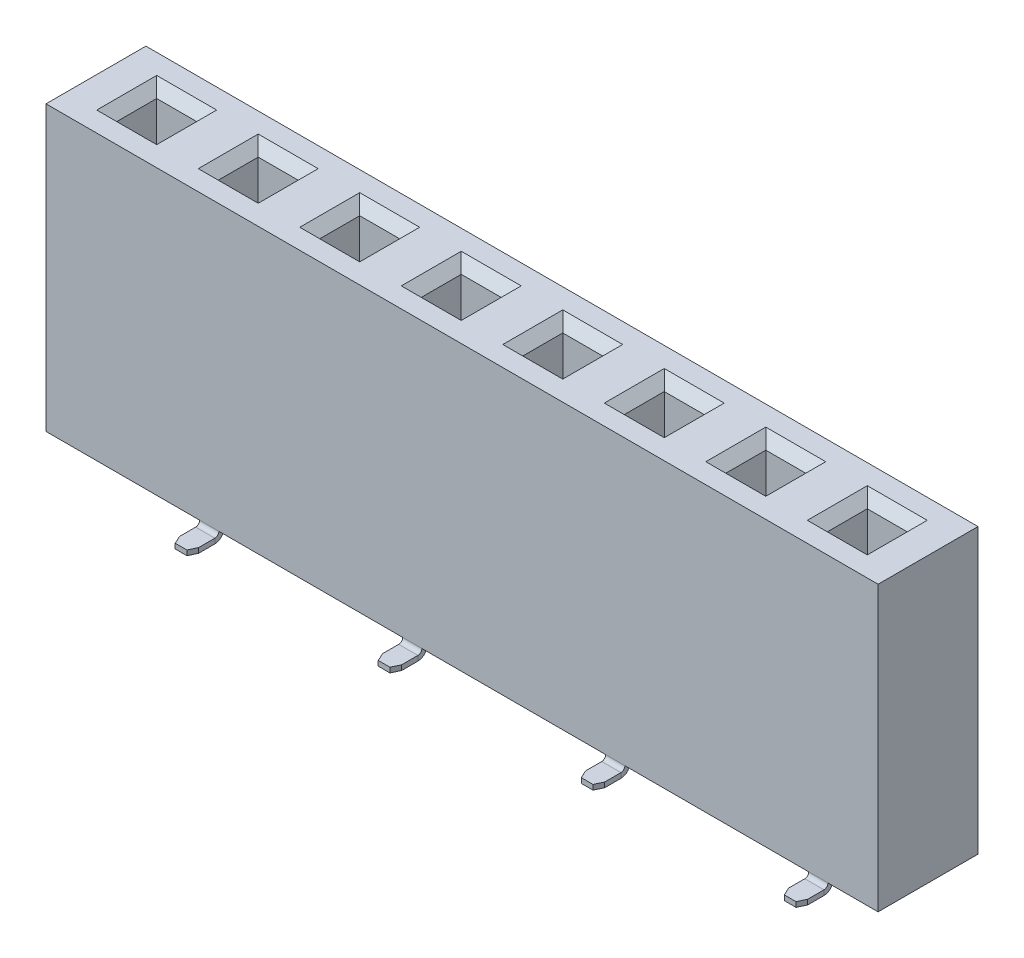
from build123d import *
from OCP.BRepFilletAPI import BRepFilletAPI_MakeChamfer

# Parameters (mm, degrees)
SKETCH1_W                  = 20.82
SKETCH1_H                  = 7.1
BOSS_EXTRUDE1_DEPTH        = 2.5
SKETCH2_W                  = 1
SKETCH2_H                  = 1
CUT_EXTRUDE1_DEPTH         = 2.5
CHAMFER1_SIZE              = 0.25
LPATTERN6_COUNT            = 8
LPATTERN6_PITCH            = 2.54
CHAMFER1_OF_LPATTERN6_SIZE = 0.25
BASE_FLANGE2_DEPTH         = 0.24
BASE_FLANGE2_DEPTH_BACK    = 0.24
BASE_FLANGE3_DEPTH         = 0.24
BASE_FLANGE3_DEPTH_BACK    = 0.24
CHAMFER3_SIZE              = 0.2
CHAMFER3_SIZE2             = 0.093261532
CHAMFER4_SIZE              = 0.2
CHAMFER4_SIZE2             = 0.093261532
LPATTERN4_COUNT            = 4
LPATTERN4_PITCH            = 5.08
LPATTERN3_COUNT            = 4
LPATTERN3_PITCH            = 5.08


# Sheet-metal steps are written as plain solids
with BuildPart() as part:
    # Sketch1 → Boss-Extrude1 (new body)
    with BuildSketch(Plane.XY):
        Rectangle(SKETCH1_W, SKETCH1_H)
    extrude(amount=BOSS_EXTRUDE1_DEPTH)

    # Sketch2 → Cut-Extrude1 (cut)
    with BuildSketch(Plane(origin=(0, 3.55, 0), x_dir=(1, 0, 0), z_dir=(0, 1, 0))):
        with Locations((-8.89, -1.25)):
            Rectangle(SKETCH2_W, SKETCH2_H)
    cut_extrude1 = extrude(amount=-CUT_EXTRUDE1_DEPTH, mode=Mode.SUBTRACT)

    # Chamfer1
    chamfer1_edges = [part.edges().sort_by_distance(p)[0] for p in [
        (-8.39, 3.55, 1.25),
        (-8.89, 3.55, 0.75),
        (-9.39, 3.55, 1.25),
        (-8.89, 3.55, 1.75),
    ]]
    chamfer(chamfer1_edges, length=CHAMFER1_SIZE)

    # LPattern6: Cut-Extrude1 ×8
    with Locations(*[(i * LPATTERN6_PITCH, 0, 0) for i in range(1, LPATTERN6_COUNT)]):
        add(cut_extrude1, mode=Mode.SUBTRACT)

    # Chamfer1 of LPattern6
    chamfer1_of_lpattern6_edges = [part.edges().sort_by_distance(p)[0] for p in [
        (-5.85, 3.55, 1.25),
        (-6.35, 3.55, 0.75),
        (-6.85, 3.55, 1.25),
        (-6.35, 3.55, 1.75),
        (-3.31, 3.55, 1.25),
        (-3.81, 3.55, 0.75),
        (-4.31, 3.55, 1.25),
        (-3.81, 3.55, 1.75),
        (-0.77, 3.55, 1.25),
        (-1.27, 3.55, 0.75),
        (-1.77, 3.55, 1.25),
        (-1.27, 3.55, 1.75),
        (1.77, 3.55, 1.25),
        (1.27, 3.55, 0.75),
        (0.77, 3.55, 1.25),
        (1.27, 3.55, 1.75),
        (4.31, 3.55, 1.25),
        (3.81, 3.55, 0.75),
        (3.31, 3.55, 1.25),
        (3.81, 3.55, 1.75),
        (6.85, 3.55, 1.25),
        (6.35, 3.55, 0.75),
        (5.85, 3.55, 1.25),
        (6.35, 3.55, 1.75),
        (9.39, 3.55, 1.25),
        (8.89, 3.55, 0.75),
        (8.39, 3.55, 1.25),
        (8.89, 3.55, 1.75),
    ]]
    chamfer(chamfer1_of_lpattern6_edges, length=CHAMFER1_OF_LPATTERN6_SIZE)


with BuildPart() as body_2:
    # Sketch5 → Base-Flange2 (new, two sides: drawn at the far end of the back side and taken through both)
    with BuildSketch(Plane.ZY.offset(8.89).offset(-BASE_FLANGE2_DEPTH_BACK)):
        with BuildLine():
            Line((0.15, -3.55), (0.15, -3.575))
            ThreePointArc((0.15, -3.575), (0.084099026, -3.734099026), (-0.075, -3.8))
            Line((-0.075, -3.8), (-0.68, -3.8))
            Line((-0.68, -3.8), (-0.68, -3.675))
            Line((-0.68, -3.675), (-0.075, -3.675))
            ThreePointArc((-0.075, -3.675), (-0.004289322, -3.645710678), (0.025, -3.575))
            Line((0.025, -3.575), (0.025, -3.55))
            Line((0.025, -3.55), (0.15, -3.55))
        make_face()
    extrude(amount=BASE_FLANGE2_DEPTH + BASE_FLANGE2_DEPTH_BACK)

    # Chamfer4: one chamfer whose edges measure the first distance from different faces: ONE call of the kernel's chamfer builder (chamfer() names one face for all edges)
    chamfer4_edges_1 = [body_2.edges().sort_by_distance(p)[0] for p in [
        (-8.65, -3.7375, -0.68),
    ]]
    chamfer4_side_1 = [body_2.faces().sort_by_distance(p)[0] for p in [
        (-8.65, -3.717002494, -0.245845427),
    ]]
    chamfer4_edges_2 = [body_2.edges().sort_by_distance(p)[0] for p in [
        (-9.13, -3.7375, -0.68),
    ]]
    chamfer4_side_2 = [body_2.faces().sort_by_distance(p)[0] for p in [
        (-9.13, -3.717002494, -0.245845427),
    ]]
    chamfer4 = BRepFilletAPI_MakeChamfer(body_2.part.solid().wrapped)
    for e in chamfer4_edges_1:
        chamfer4.Add(CHAMFER4_SIZE, CHAMFER4_SIZE2, e.wrapped, chamfer4_side_1[0].wrapped)  # the first distance lies on this face
    for e in chamfer4_edges_2:
        chamfer4.Add(CHAMFER4_SIZE, CHAMFER4_SIZE2, e.wrapped, chamfer4_side_2[0].wrapped)  # the first distance lies on this face
    add(Compound.cast(chamfer4.Shape()), mode=Mode.REPLACE)


with BuildPart() as body_3:
    # Sketch22 → Base-Flange3 (new, two sides: drawn at the far end of the back side and taken through both)
    with BuildSketch(Plane.ZY.offset(6.35).offset(-BASE_FLANGE3_DEPTH_BACK)):
        with BuildLine():
            Line((2.35, -3.55), (2.35, -3.575))
            ThreePointArc((2.35, -3.575), (2.415900974, -3.734099026), (2.575, -3.8))
            Line((2.575, -3.8), (3.18, -3.8))
            Line((3.18, -3.8), (3.18, -3.675))
            Line((3.18, -3.675), (2.575, -3.675))
            ThreePointArc((2.575, -3.675), (2.504289322, -3.645710678), (2.475, -3.575))
            Line((2.475, -3.575), (2.475, -3.55))
            Line((2.475, -3.55), (2.35, -3.55))
        make_face()
    extrude(amount=BASE_FLANGE3_DEPTH + BASE_FLANGE3_DEPTH_BACK)

    # Chamfer3: one chamfer whose edges measure the first distance from different faces: ONE call of the kernel's chamfer builder (chamfer() names one face for all edges)
    chamfer3_edges_1 = [body_3.edges().sort_by_distance(p)[0] for p in [
        (-6.11, -3.7375, 3.18),
    ]]
    chamfer3_side_1 = [body_3.faces().sort_by_distance(p)[0] for p in [
        (-6.11, -3.717002494, 2.745845427),
    ]]
    chamfer3_edges_2 = [body_3.edges().sort_by_distance(p)[0] for p in [
        (-6.59, -3.7375, 3.18),
    ]]
    chamfer3_side_2 = [body_3.faces().sort_by_distance(p)[0] for p in [
        (-6.59, -3.717002494, 2.745845427),
    ]]
    chamfer3 = BRepFilletAPI_MakeChamfer(body_3.part.solid().wrapped)
    for e in chamfer3_edges_1:
        chamfer3.Add(CHAMFER3_SIZE, CHAMFER3_SIZE2, e.wrapped, chamfer3_side_1[0].wrapped)  # the first distance lies on this face
    for e in chamfer3_edges_2:
        chamfer3.Add(CHAMFER3_SIZE, CHAMFER3_SIZE2, e.wrapped, chamfer3_side_2[0].wrapped)  # the first distance lies on this face
    add(Compound.cast(chamfer3.Shape()), mode=Mode.REPLACE)


with BuildPart() as lpattern4_1:
    # LPattern4: pattern copy
    add(body_2.part.moved(Location(Vector(1, 0, 0) * (1 * LPATTERN4_PITCH))))


with BuildPart() as lpattern4_2:
    # LPattern4: pattern copy
    add(body_2.part.moved(Location(Vector(1, 0, 0) * (2 * LPATTERN4_PITCH))))


with BuildPart() as lpattern4_3:
    # LPattern4: pattern copy
    add(body_2.part.moved(Location(Vector(1, 0, 0) * (3 * LPATTERN4_PITCH))))


with BuildPart() as lpattern3_1:
    # LPattern3: pattern copy
    add(body_3.part.moved(Location(Vector(1, 0, 0) * (1 * LPATTERN3_PITCH))))


with BuildPart() as lpattern3_2:
    # LPattern3: pattern copy
    add(body_3.part.moved(Location(Vector(1, 0, 0) * (2 * LPATTERN3_PITCH))))


with BuildPart() as lpattern3_3:
    # LPattern3: pattern copy
    add(body_3.part.moved(Location(Vector(1, 0, 0) * (3 * LPATTERN3_PITCH))))


solid = Compound([part.part, body_2.part, body_3.part, lpattern4_1.part, lpattern4_2.part, lpattern4_3.part, lpattern3_1.part, lpattern3_2.part, lpattern3_3.part])
